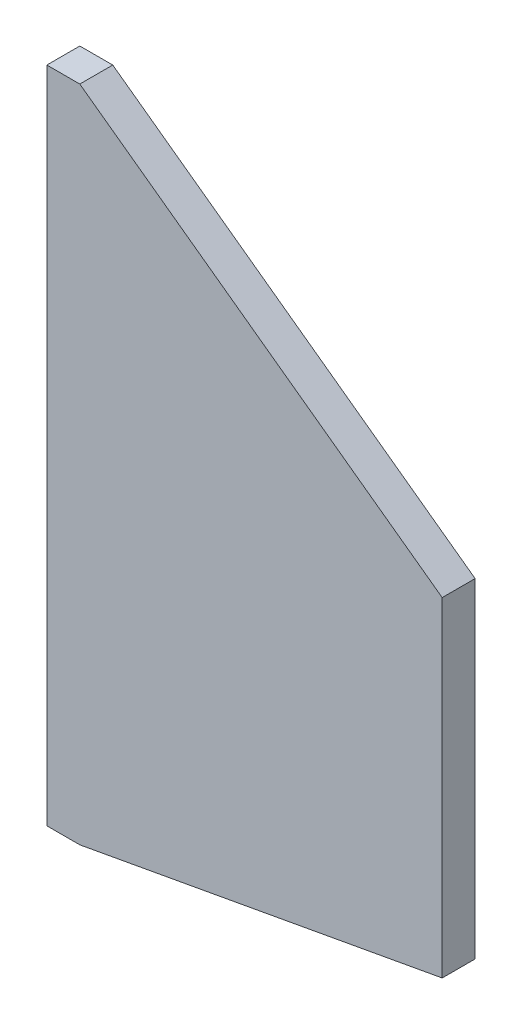
from build123d import *

# Parameters (mm, degrees)
BOSS_EXTRUDE1_DEPTH = 5.08


with BuildPart() as part:
    # Sketch2 → Boss-Extrude1 (new body)
    with BuildSketch(Plane.XY):
        Polygon((0, 0), (5.08, 0), (60.96, 10.16), (60.96, 60.96), (5.08, 101.6), (0, 101.6), align=None)
    extrude(amount=BOSS_EXTRUDE1_DEPTH)


solid = part.part
